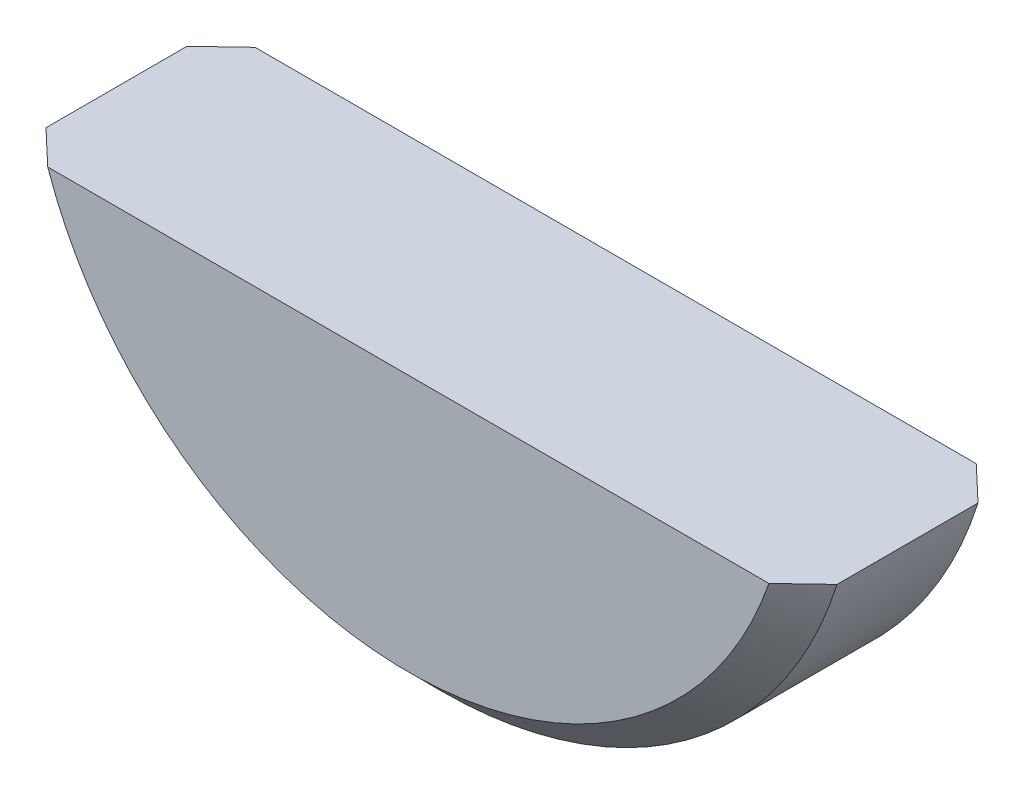
from build123d import *

# Parameters (mm, degrees)
BASEBODY_DEPTH = 1
CHAMFER_2_SIZE = 0.16


with BuildPart() as part:
    # BodySke → BaseBody (new body)
    with BuildSketch(Plane.XY):
        with BuildLine():
            Line((-1.907878403, 1.4), (1.907878403, 1.4))
            ThreePointArc((1.907878403, 1.4), (0, 0), (-1.907878403, 1.4))
        make_face()
    extrude(amount=BASEBODY_DEPTH)

    # Chamfer 2
    chamfer_2_edges = [part.edges().sort_by_distance(p)[0] for p in [
        (0, 0, 0),
        (0, 0, 1),
    ]]
    chamfer(chamfer_2_edges, length=CHAMFER_2_SIZE)


solid = part.part
